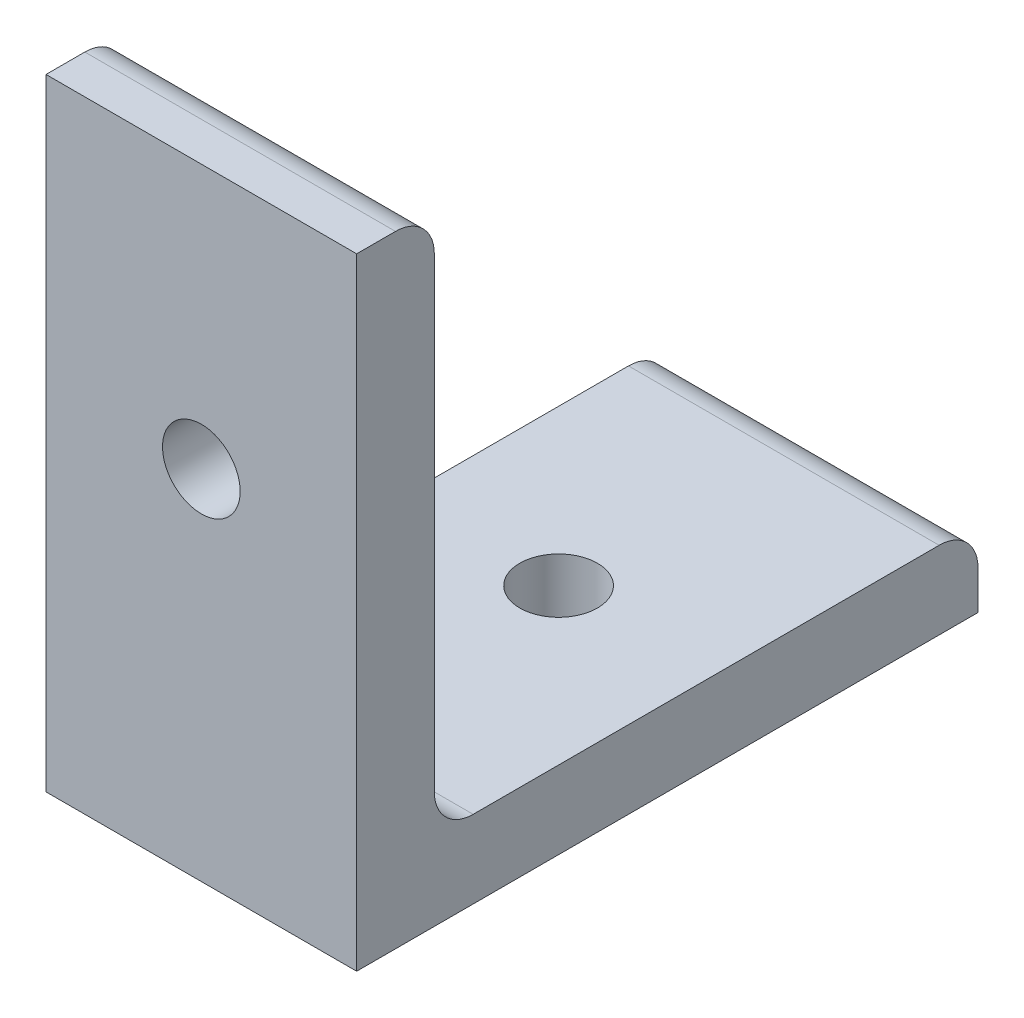
from build123d import *

# Parameters (mm, degrees)
BOSS_EXTRUDE1_DEPTH = 25.4
CUT_EXTRUDE1_REACH  = 78.2
SKETCH2_R           = 3.175
CUT_EXTRUDE2_REACH  = 74.122
SKETCH3_R           = 3.175
FILLET1_R           = 3.175
FILLET2_R           = 3.175


with BuildPart() as part:
    # Sketch1 → Boss-Extrude1 (new body)
    with BuildSketch(Plane(origin=(0, 0, 0), x_dir=(0, 0, -1), z_dir=(1, 0, 0))):
        Polygon((0, 0), (50.8, 0), (50.8, 6.35), (6.35, 6.35), (6.35, 50.8), (0, 50.8), align=None)
    extrude(amount=BOSS_EXTRUDE1_DEPTH)

    # Sketch2 → Cut-Extrude1 (cut, up to next)
    with BuildSketch(Plane.XY, mode=Mode.PRIVATE) as cut_extrude1_sk1:
        with Locations((12.7, 29.21)):
            Circle(SKETCH2_R)
    cut_extrude1_tool1 = extrude(cut_extrude1_sk1.sketch, amount=-CUT_EXTRUDE1_REACH, mode=Mode.PRIVATE) & part.part
    add(cut_extrude1_tool1.solids().sort_by_distance((12.7, 29.21, 0))[0], mode=Mode.SUBTRACT)

    # Sketch3 → Cut-Extrude2 (cut, up to next)
    with BuildSketch(Plane(origin=(0, 6.35, 0), x_dir=(1, 0, 0), z_dir=(0, 1, 0)), mode=Mode.PRIVATE) as cut_extrude2_sk1:
        with Locations((12.7, 29.21)):
            Circle(SKETCH3_R)
    cut_extrude2_tool1 = extrude(cut_extrude2_sk1.sketch, amount=-CUT_EXTRUDE2_REACH, mode=Mode.PRIVATE) & part.part
    add(cut_extrude2_tool1.solids().sort_by_distance((12.7, 6.35, -29.21))[0], mode=Mode.SUBTRACT)

    # Fillet1
    fillet1_edges = [part.edges().sort_by_distance(p)[0] for p in [
        (12.7, 6.35, -6.35),
    ]]
    fillet(fillet1_edges, radius=FILLET1_R)

    # Fillet2
    fillet2_edges = [part.edges().sort_by_distance(p)[0] for p in [
        (12.7, 50.8, -6.35),
        (12.7, 6.35, -50.8),
    ]]
    fillet(fillet2_edges, radius=FILLET2_R)


solid = part.part
